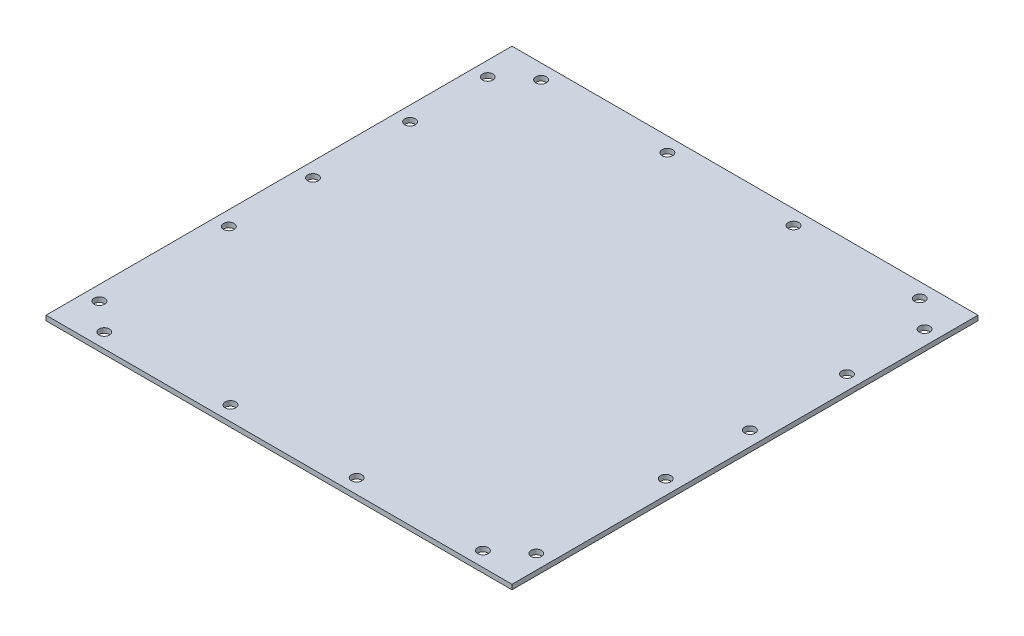
from build123d import *

# Parameters (mm, degrees)
SKETCH2_W                 = 152.4
SKETCH2_H                 = 152.4
BOSS_EXTRUDE1_DEPTH       = 1.5875
F_5_CLEARANCE_HOLE2_D     = 3.4544
F_5_CLEARANCE_HOLE3_D     = 3.4544
LPATTERN1_COUNT           = 4
LPATTERN1_PITCH           = 42.333333333
LPATTERN2_COUNT           = 4
LPATTERN2_PITCH           = 41.275
F_5_CLEARANCE_HOLE4_D     = 3.4544
F_5_CLEARANCE_HOLE4_DEPTH = 12.7
F_5_CLEARANCE_HOLE4_TIP   = 1.037806461


with BuildPart() as part:
    # Sketch2 → Boss-Extrude1 (new body)
    with BuildSketch(Plane(origin=(0, 0, 0), x_dir=(1, 0, 0), z_dir=(0, 1, 0))):
        with Locations((76.2, 76.2)):
            Rectangle(SKETCH2_W, SKETCH2_H)
    extrude(amount=BOSS_EXTRUDE1_DEPTH)

    # #5 Clearance Hole2 (through all)
    with Locations(Plane(origin=(0, 1.5875, 0), x_dir=(1, 0, 0), z_dir=(0, 1, 0))):
        with Locations((14.2875, 147.6375), (14.2875, 4.7625)):
            f_5_clearance_hole2 = Hole(F_5_CLEARANCE_HOLE2_D / 2)

    # #5 Clearance Hole3 (through all)
    with Locations(Plane(origin=(0, 1.5875, 0), x_dir=(1, 0, 0), z_dir=(0, 1, 0))):
        with Locations((4.7625, 139.7), (147.6375, 139.7)):
            f_5_clearance_hole3 = Hole(F_5_CLEARANCE_HOLE3_D / 2)

    # LPattern1: #5 Clearance Hole3 ×4, 1 skipped
    with Locations(*[(0, 0, i * LPATTERN1_PITCH) for i in range(1, LPATTERN1_COUNT) if i not in (1,)]):
        add(f_5_clearance_hole3, mode=Mode.SUBTRACT)

    # LPattern2: #5 Clearance Hole2 ×4
    with Locations(*[(i * LPATTERN2_PITCH, 0, 0) for i in range(1, LPATTERN2_COUNT)]):
        add(f_5_clearance_hole2, mode=Mode.SUBTRACT)

    # #5 Clearance Hole4
    with Locations(Plane(origin=(0, 1.5875, 0), x_dir=(1, 0, 0), z_dir=(0, 1, 0))):
        with Locations((147.6375, 114.3), (147.6375, 82.55), (4.7625, 82.55), (4.7625, 114.3)):
            Hole(F_5_CLEARANCE_HOLE4_D / 2, depth=F_5_CLEARANCE_HOLE4_DEPTH)
            with Locations((0, 0, -(F_5_CLEARANCE_HOLE4_DEPTH + F_5_CLEARANCE_HOLE4_TIP / 2))):  # 118° drill point
                Cone(0, F_5_CLEARANCE_HOLE4_D / 2, F_5_CLEARANCE_HOLE4_TIP, mode=Mode.SUBTRACT)


solid = part.part
